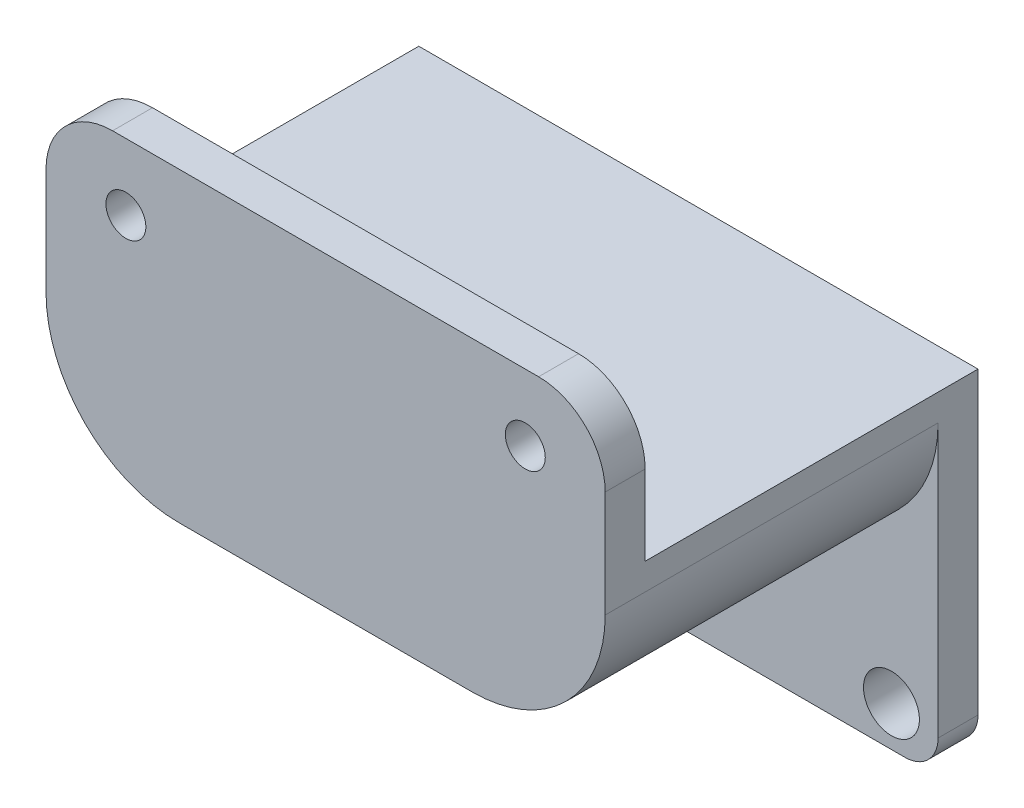
from build123d import *

# Parameters (mm, degrees)
SKETCH3_R           = 1.5
BOSS_EXTRUDE3_DEPTH = 3
BOSS_EXTRUDE4_START = -25
BOSS_EXTRUDE4_DEPTH = 25
FILLET4_R           = 5
SKETCH9_W           = 42
SKETCH9_H           = 3
BOSS_EXTRUDE7_DEPTH = 30
FILLET6_R           = 5
FILLET7_R           = 5
SKETCH11_R          = 2.1
CUT_EXTRUDE2_DEPTH  = 30
SKETCH12_W          = 44.285709781
SKETCH12_H          = 6.975595145
CUT_EXTRUDE3_DEPTH  = 10
FILLET8_R           = 2.5


with BuildPart() as part:
    # Sketch3 → Boss-Extrude3 (new body)
    with BuildSketch(Plane.XY):
        with BuildLine():
            Line((-22.592834793, 16.50935751), (-6.092834793, 16.50935751))
            Line((-6.092834793, 16.50935751), (-6.092834793, 3.50935751))
            ThreePointArc((-6.092834793, 3.50935751), (-9.021766981, -3.561710302), (-16.092834793, -6.49064249))
            Line((-16.092834793, -6.49064249), (-38.092834793, -6.49064249))
            ThreePointArc((-38.092834793, -6.49064249), (-45.163902605, -3.561710302), (-48.092834793, 3.50935751))
            Line((-48.092834793, 3.50935751), (-48.092834793, 16.50935751))
            Line((-48.092834793, 16.50935751), (-31.592834793, 16.50935751))
            Line((-31.592834793, 16.50935751), (-22.592834793, 16.50935751))
        make_face()
        with Locations((-42.092834793, 11.50935751)):
            Circle(SKETCH3_R, mode=Mode.SUBTRACT)
        with Locations((-12.092834793, 11.50935751)):
            Circle(SKETCH3_R, mode=Mode.SUBTRACT)
    extrude(amount=BOSS_EXTRUDE3_DEPTH)

    # Sketch6 → Boss-Extrude4 (add)
    with BuildSketch(Plane.XY.offset(BOSS_EXTRUDE4_START)):
        with BuildLine():
            Line((-48.092834793, 5.50935751), (-48.092834793, 3.50935751))
            ThreePointArc((-48.092834793, 3.50935751), (-45.163902605, -3.561710302), (-38.092834793, -6.49064249))
            Line((-38.092834793, -6.49064249), (-16.092834793, -6.49064249))
            ThreePointArc((-16.092834793, -6.49064249), (-9.021766981, -3.561710302), (-6.092834793, 3.50935751))
            Line((-6.092834793, 3.50935751), (-6.092834793, 5.50935751))
            Line((-6.092834793, 5.50935751), (-48.092834793, 5.50935751))
        make_face()
    extrude(amount=BOSS_EXTRUDE4_DEPTH)

    # Fillet4
    fillet4_edges = [part.edges().sort_by_distance(p)[0] for p in [
        (-48.092834793, 16.50935751, 1.5),
        (-6.092834793, 16.50935751, 1.5),
    ]]
    fillet(fillet4_edges, radius=FILLET4_R)

    # Sketch9 → Boss-Extrude7 (add)
    with BuildSketch(Plane(origin=(0, 5.50935751, 0), x_dir=(1, 0, 0), z_dir=(0, 1, 0))):
        with Locations((-27.092834793, 23.5)):
            Rectangle(SKETCH9_W, SKETCH9_H)
    extrude(amount=-BOSS_EXTRUDE7_DEPTH)

    # Fillet6
    fillet6_edges = [part.edges().sort_by_distance(p)[0] for p in [
        (-6.092834793, -24.49064249, -23.5),
    ]]
    fillet(fillet6_edges, radius=FILLET6_R)

    # Fillet7
    fillet7_edges = [part.edges().sort_by_distance(p)[0] for p in [
        (-48.092834793, -24.49064249, -23.5),
    ]]
    fillet(fillet7_edges, radius=FILLET7_R)

    # Sketch11 → Cut-Extrude2 (cut)
    with BuildSketch(Plane(origin=(0, 0, -25), x_dir=(-1, 0, 0), z_dir=(0, 0, -1))):
        with Locations((9.592834793, -16.49064249)):
            Circle(SKETCH11_R)
        with Locations((44.592834793, -16.49064249)):
            Circle(SKETCH11_R)
        with BuildLine():
            Line((22.592834793, -24.49064249), (31.592834793, -24.49064249))
            ThreePointArc((31.592834793, -24.49064249), (27.092834793, -19.99064249), (22.592834793, -24.49064249))
        make_face()
    extrude(amount=-CUT_EXTRUDE2_DEPTH, mode=Mode.SUBTRACT)

    # Sketch12 → Cut-Extrude3 (cut)
    with BuildSketch(Plane(origin=(0, 0, -25), x_dir=(-1, 0, 0), z_dir=(0, 0, -1))):
        with Locations((28.235689684, -22.978440063)):
            Rectangle(SKETCH12_W, SKETCH12_H)
    extrude(amount=-CUT_EXTRUDE3_DEPTH, mode=Mode.SUBTRACT)

    # Fillet8
    fillet8_edges = [part.edges().sort_by_distance(p)[0] for p in [
        (-48.092834793, -19.49064249, -23.5),
        (-6.092834793, -19.49064249, -23.5),
    ]]
    fillet(fillet8_edges, radius=FILLET8_R)


solid = part.part
